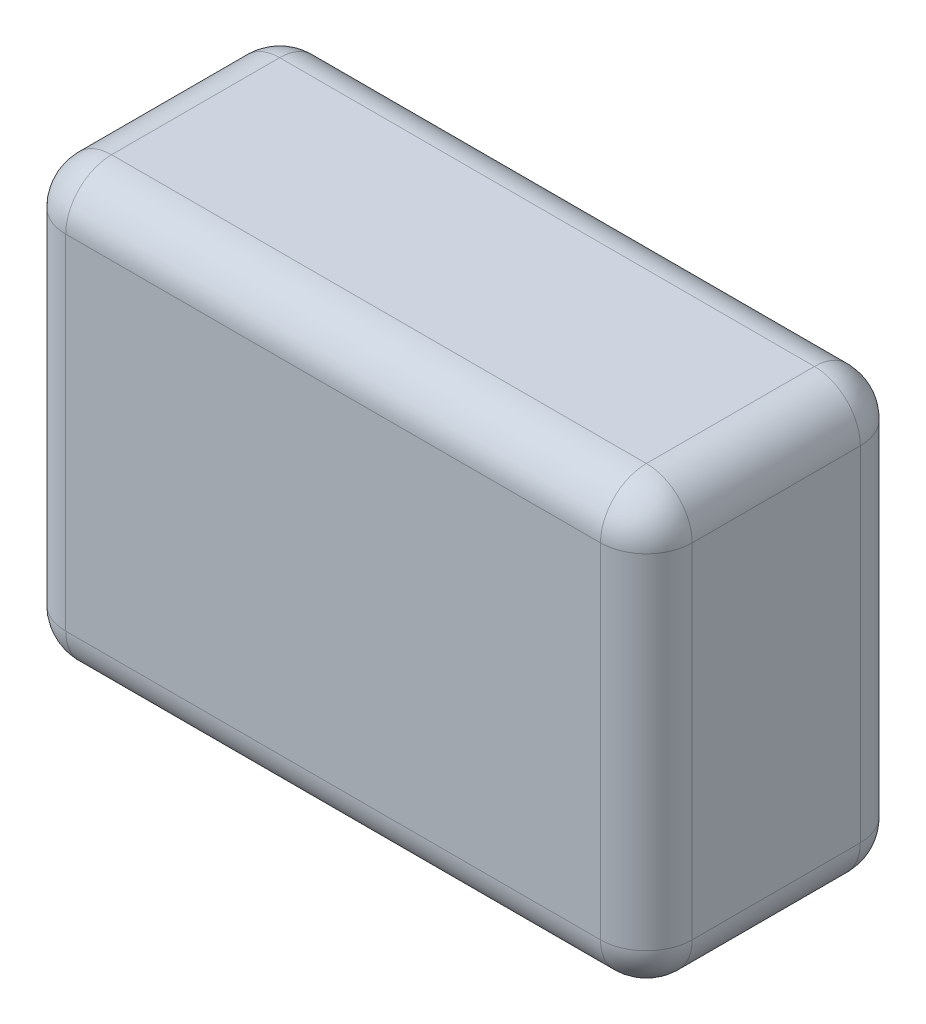
from build123d import *

# Parameters (mm, degrees)
SKETCH1_W           = 82
SKETCH1_H           = 34
BOSS_EXTRUDE1_DEPTH = 28.5
FILLET1_R           = 6


with BuildPart() as part:
    # Sketch1 → Boss-Extrude1 (new, symmetric)
    with BuildSketch(Plane(origin=(0, 0, 0), x_dir=(1, 0, 0), z_dir=(0, 1, 0))):
        Rectangle(SKETCH1_W, SKETCH1_H)
    extrude(amount=BOSS_EXTRUDE1_DEPTH, both=True)

    # Fillet1
    fillet1_edges = [part.edges().sort_by_distance(p)[0] for p in [
        (-41, 0, 17),
        (41, 0, 17),
        (41, 0, -17),
        (-41, 0, -17),
        (0, 28.5, -17),
        (41, 28.5, 0),
        (0, 28.5, 17),
        (-41, 28.5, 0),
        (0, -28.5, -17),
        (41, -28.5, 0),
        (0, -28.5, 17),
        (-41, -28.5, 0),
    ]]
    fillet(fillet1_edges, radius=FILLET1_R)


solid = part.part
